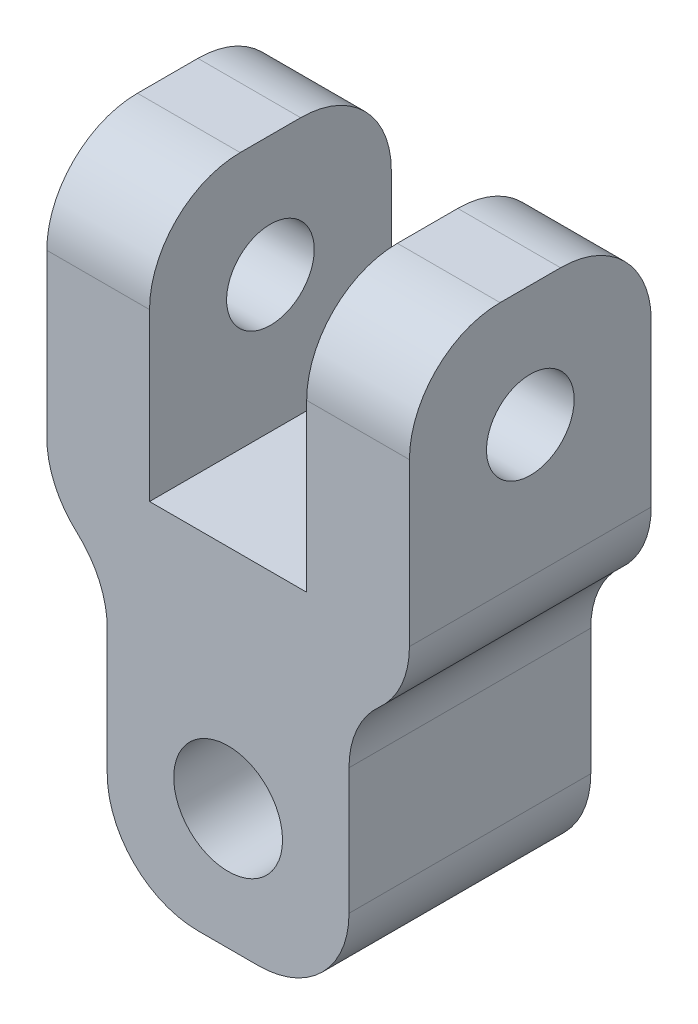
from build123d import *

# Parameters (mm, degrees)
SKETCH_1_W          = 8
SKETCH_1_H          = 8
EXTRUDE_1_DEPTH     = 20
SKETCH_2_R          = 1.8
CUT_EXTRUDE_1_DEPTH = 23.978250586
SKETCH_4_W          = 2
SKETCH_4_H          = 8
EXTRUDE_3_DEPTH     = 10
SKETCH_5_W          = 5.2
SKETCH_5_H          = 8.5
CUT_EXTRUDE_2_DEPTH = 24.748684174
FILLET_1_R          = 3
SKETCH_6_R          = 1.45
CUT_EXTRUDE_3_DEPTH = 25.657656012
FILLET_2_R          = 3


with BuildPart() as part:
    # 草图1 → 凸台-拉伸1 (new body)
    with BuildSketch(Plane(origin=(0, 0, 0), x_dir=(1, 0, 0), z_dir=(0, 1, 0))):
        with Locations((4, -4)):
            Rectangle(SKETCH_1_W, SKETCH_1_H)
    extrude(amount=EXTRUDE_1_DEPTH)

    # 草图2 → 切除-拉伸1 (cut, through all)
    with BuildSketch(Plane.XY.offset(8)):
        with Locations((4, 4)):
            Circle(SKETCH_2_R)
    extrude(amount=-CUT_EXTRUDE_1_DEPTH, mode=Mode.SUBTRACT)

    # 草图4 → 凸台-拉伸3 (add)
    with BuildSketch(Plane(origin=(0, 20, 0), x_dir=(1, 0, 0), z_dir=(0, 1, 0))):
        with Locations((-1, -4)):
            Rectangle(SKETCH_4_W, SKETCH_4_H)
        with Locations((9, -4)):
            Rectangle(SKETCH_4_W, SKETCH_4_H)
    extrude(amount=-EXTRUDE_3_DEPTH)

    # 草图5 → 切除-拉伸2 (cut, through all)
    with BuildSketch(Plane.XY.offset(8)):
        with Locations((4, 15.75)):
            Rectangle(SKETCH_5_W, SKETCH_5_H)
    extrude(amount=-CUT_EXTRUDE_2_DEPTH, mode=Mode.SUBTRACT)

    # 圆角1
    # the kernel refuses this fillet: 3 mm, written as the material it adds along each edge
    with BuildSketch(Plane(origin=(8, 10, 8), x_dir=(0, -1, 0), z_dir=(0, 0, -1))) as fillet_1_piece_1:
        with BuildLine():
            CenterArc((2.828427125, -3), FILLET_1_R, 90, 70.528779366)
            Line((0, -2), (-0.056568542, -1.98))
            ThreePointArc((-0.056568542, -1.98), (-0.06, -1), (-0.06, 0))
            Line((-0.06, 0), (0, 0.06))
            Line((0, 0.06), (2.828427125, 0.06))
            Line((2.828427125, 0.06), (2.828427125, 0))
        make_face()
    extrude(amount=8)
    with BuildSketch(Plane(origin=(0, 10, 8), x_dir=(-1, 0, 0), z_dir=(0, 0, -1))) as fillet_1_piece_2:
        with BuildLine():
            CenterArc((3, -2.828427125), FILLET_1_R, 109.471220634, 70.528779366)
            Line((0, -2.828427125), (-0.06, -2.828427125))
            Line((-0.06, -2.828427125), (-0.06, 0))
            Line((-0.06, 0), (0, 0.06))
            ThreePointArc((0, 0.06), (1, 0.06), (1.98, 0.056568542))
            Line((1.98, 0.056568542), (2, 0))
        make_face()
    extrude(amount=8)

    # 草图6 → 切除-拉伸3 (cut, through all)
    with BuildSketch(Plane(origin=(10, 0, 0), x_dir=(0, 0, -1), z_dir=(1, 0, 0))):
        with Locations((-4, 16)):
            Circle(SKETCH_6_R)
    extrude(amount=-CUT_EXTRUDE_3_DEPTH, mode=Mode.SUBTRACT)

    # 圆角2
    fillet_2_edges = [part.edges().sort_by_distance(p)[0] for p in [
        (8.3, 20, 0),
        (-2, 10, 4),
        (10, 10, 4),
        (-0.3, 20, 0),
        (8.3, 20, 8),
        (8, 0, 4),
        (0, 0, 4),
        (-0.3, 20, 8),
    ]]
    fillet(fillet_2_edges, radius=FILLET_2_R)


solid = part.part
